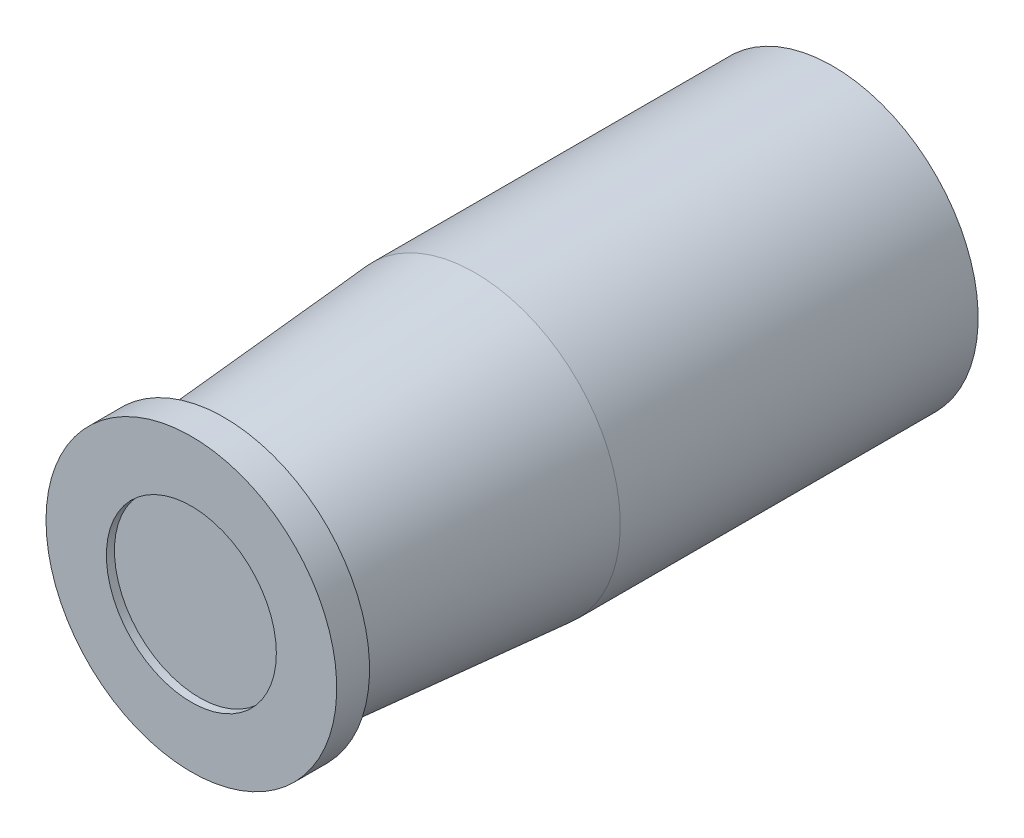
from build123d import *

# Parameters (mm, degrees)
SKETCH2_R          = 2.85
CUT_EXTRUDE1_DEPTH = 0.27


with BuildPart() as part:
    # Sketch1 → Revolve1 (revolve)
    with BuildSketch(Plane(origin=(0, 0, 0), x_dir=(1, 0, 0), z_dir=(0, 1, 0))):
        Polygon((0, 0), (-4.875, 0), (-4.875, 1.1), (-4.215, 1.1), (-4.875, 9.51), (-4.875, 21.51), (0, 21.51), align=None)
    revolve(axis=Axis((0, 0, -21.51), (0, 0, 1)))

    # Sketch2 → Cut-Extrude1 (cut)
    with BuildSketch(Plane.XY):
        Circle(SKETCH2_R)
    extrude(amount=-CUT_EXTRUDE1_DEPTH, mode=Mode.SUBTRACT)


solid = part.part
